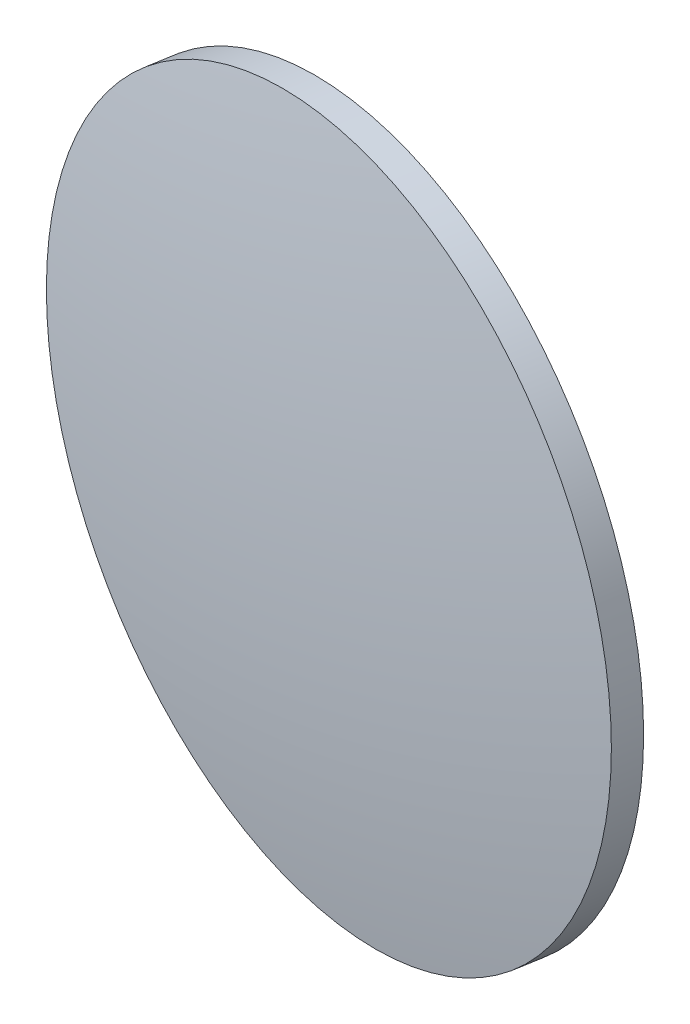
from build123d import *
from build123d.topology import SkipClean

# Parameters (mm, degrees)
SKETCH4_W          = 136.14923221
SKETCH4_H          = 136.469884352
SKETCH4_R          = 50
CUT_EXTRUDE2_DEPTH = 115.679222781


with BuildPart() as part:
    # Sweep2: sweep along a path in Sketch2
    with BuildLine(Plane(origin=(0, 0, 0), x_dir=(1, 0, 0), z_dir=(0, 1, 0))) as sweep2_path:
        ThreePointArc((-98.601329718, 16.666666667), (-50, 4.196010845), (0, 0))
    # Sketch1 → Sweep2 (sweep)
    with BuildSketch(Plane(origin=(0, 0, 0), x_dir=(0, 0, -1), z_dir=(1, 0, 0))):
        with BuildLine():
            Line((4.196010845, 50), (0.140032682, 50))
            ThreePointArc((0.140032682, 50), (-4, 0), (0.140032682, -50))
            Line((0.140032682, -50), (4.196010845, -50))
            ThreePointArc((4.196010845, -50), (0, 0), (4.196010845, 50))
        make_face()
    sweep(path=sweep2_path.line)

    # Sketch4 → Cut-Extrude2 (cut, through all)
    with SkipClean():  # the faces are left unmerged after this step: merging them gives an invalid solid
        with BuildSketch(Plane(origin=(-0.811930682, 0, 8.175030791), x_dir=(0.9860132971832695, 0, 0.1666666666666664), z_dir=(-0.1666666666666664, 0, 0.9860132971832695))):
            with Locations((-53.775894029, -1.672479888)):
                Rectangle(SKETCH4_W, SKETCH4_H)
            with Locations((-50.561930682, 0)):
                Circle(SKETCH4_R, mode=Mode.SUBTRACT)
        extrude(amount=-CUT_EXTRUDE2_DEPTH, mode=Mode.SUBTRACT)


solid = part.part
